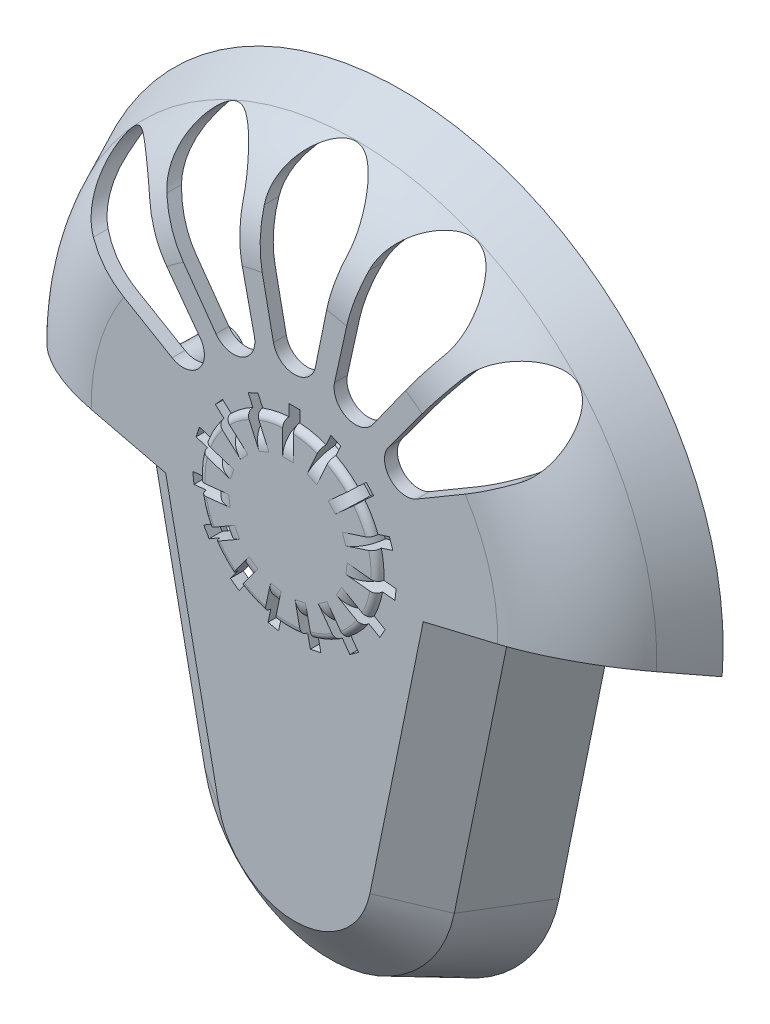
from build123d import *
from OCP.BRepFilletAPI import BRepFilletAPI_MakeChamfer

# Parameters (mm, degrees)
BOSS_EXTRUDE1_DEPTH           = 12.7
BOSS_EXTRUDE1_DRAFT           = 25
FILLET1_R                     = 12.7
CHAMFER1_SIZE                 = 4.5974
CHAMFER1_SIZE2                = 4.007661149
SHELL9_T                      = -1.524
CUT_EXTRUDE3_START            = -25.4
CUT_EXTRUDE3_DEPTH            = 90.87598769
SKETCH3_R                     = 10.6045
BOSS_EXTRUDE2_DEPTH           = 0.762
CUT_EXTRUDE5_START            = -65.757547933
SKETCH4_W                     = 1.27
SKETCH4_H                     = 2.54
CUT_EXTRUDE5_DEPTH            = 70.075547933
FILLET3_R                     = 0.762
FILLET10_R                    = 2.54
CIRPATTERN1_START             = -0.677562942
CIRPATTERN1_DEPTH             = 1.27
CIRPATTERN1_START_2           = -0.592437058
CIRPATTERN1_2_DEPTH           = 1.27
CIRPATTERN1_START_3           = -0.557233635
CIRPATTERN1_3_DEPTH           = 1.27
CIRPATTERN1_START_4           = -0.535476723
CIRPATTERN1_4_DEPTH           = 1.27
CIRPATTERN1_START_5           = -0.73907171
CIRPATTERN1_5_DEPTH           = 1.27
CIRPATTERN1_START_6           = -0.725625199
CIRPATTERN1_6_DEPTH           = 1.27
CIRPATTERN1_START_7           = -0.696508768
CIRPATTERN1_7_DEPTH           = 1.27
CIRPATTERN1_START_8           = -0.656756912
CIRPATTERN1_8_DEPTH           = 1.27
CIRPATTERN1_START_9           = -0.613243088
CIRPATTERN1_9_DEPTH           = 1.27
CIRPATTERN1_START_10          = -0.573491232
CIRPATTERN1_10_DEPTH          = 1.27
CIRPATTERN1_START_11          = -0.544374801
CIRPATTERN1_11_DEPTH          = 1.27
CIRPATTERN1_START_12          = -0.53092829
CIRPATTERN1_12_DEPTH          = 1.27
CIRPATTERN1_START_13          = -0.734523277
CIRPATTERN1_13_DEPTH          = 1.27
CIRPATTERN1_START_14          = -0.712766365
CIRPATTERN1_14_DEPTH          = 1.27
SKETCH5_R                     = 2.2225
BOSS_EXTRUDE3_DEPTH           = 9.525
BOSS_EXTRUDE3_DRAFT           = 1
BOSS_EXTRUDE3_PROFILE_2_DEPTH = 9.525
BOSS_EXTRUDE3_PROFILE_2_DRAFT = 1
BOSS_EXTRUDE3_PROFILE_3_DEPTH = 9.525
BOSS_EXTRUDE3_PROFILE_3_DRAFT = 1
SKETCH7_R                     = 1.27
CUT_EXTRUDE6_DEPTH            = 2.54
CUT_EXTRUDE6_DRAFT            = -1
CUT_EXTRUDE6_PROFILE_2_DEPTH  = 2.54
CUT_EXTRUDE6_PROFILE_2_DRAFT  = -1
CUT_EXTRUDE6_PROFILE_3_DEPTH  = 2.54
CUT_EXTRUDE6_PROFILE_3_DRAFT  = -1
SKETCH8_R                     = 7.62
BOSS_EXTRUDE4_DEPTH           = 2.54
SKETCH9_R                     = 6.35
CUT_EXTRUDE7_DEPTH            = 2.54


# Read off the part's stored shape, not the designer's step: CirPattern1
# Some blends are built 0.0001 mm under size
with BuildPart() as part:
    # Sketch1 → Boss-Extrude1 (with draft: the straight prism first)
    with BuildSketch(Plane.XY):
        with BuildLine():
            ThreePointArc((-18.667565623, -35.547959151), (0, -50.8), (18.667565623, -35.547959151))
            Line((18.667565623, -35.547959151), (24.607957551, -6.35))
            Line((24.607957551, -6.35), (37.970222689, -3.142003967))
            ThreePointArc((37.970222689, -3.142003967), (0, 38.1), (-37.970222689, -3.142003967))
            Line((-37.970222689, -3.142003967), (-24.607957551, -6.35))
            Line((-24.607957551, -6.35), (-18.667565623, -35.547959151))
        make_face()
    extrude(amount=BOSS_EXTRUDE1_DEPTH)
    # Boss-Extrude1: the draft: its side faces are tilted about the plane it starts from
    boss_extrude1_sides = [part.faces().sort_by_distance(p)[0] for p in [
        (-31.28909012, -4.746001984, 6.35),
        (-21.637761587, -20.948979575, 6.35),
        (0, -50.8, 6.35),
        (21.637761587, -20.948979575, 6.35),
        (31.28909012, -4.746001984, 6.35),
        (0, 38.1, 6.35),
    ]]
    draft(boss_extrude1_sides, Plane.XY, BOSS_EXTRUDE1_DRAFT)

    # Fillet1
    fillet1_edges = [part.edges().sort_by_distance(p)[0] for p in [
        (0, 32.177892741, 12.7),
    ]]
    fillet(fillet1_edges, radius=FILLET1_R)

    # Chamfer1: one chamfer whose edges measure the first distance from different faces: ONE call of the kernel's chamfer builder (chamfer() names one face for all edges)
    chamfer1_edges_1 = [part.edges().sort_by_distance(p)[0] for p in [
        (-16.210629894, -17.919772097, 12.7),
    ]]
    chamfer1_side_1 = [part.faces().sort_by_distance(p)[0] for p in [
        (-18.870339884, -19.404315655, 6.476027784),
    ]]
    chamfer1_edges_2 = [part.edges().sort_by_distance(p)[0] for p in [
        (0, -44.877892741, 12.7),
    ]]
    chamfer1_side_2 = [part.faces().sort_by_distance(p)[0] for p in [
        (0, -47.838946371, 6.35),
    ]]
    chamfer1_edges_3 = [part.edges().sort_by_distance(p)[0] for p in [
        (16.210629894, -17.919772097, 12.7),
    ]]
    chamfer1_side_3 = [part.faces().sort_by_distance(p)[0] for p in [
        (18.870339884, -19.404315655, 6.476027784),
    ]]
    chamfer1 = BRepFilletAPI_MakeChamfer(part.part.solid().wrapped)
    for e in chamfer1_edges_1:
        chamfer1.Add(CHAMFER1_SIZE, CHAMFER1_SIZE2, e.wrapped, chamfer1_side_1[0].wrapped)  # the first distance lies on this face
    for e in chamfer1_edges_2:
        chamfer1.Add(CHAMFER1_SIZE, CHAMFER1_SIZE2, e.wrapped, chamfer1_side_2[0].wrapped)  # the first distance lies on this face
    for e in chamfer1_edges_3:
        chamfer1.Add(CHAMFER1_SIZE, CHAMFER1_SIZE2, e.wrapped, chamfer1_side_3[0].wrapped)  # the first distance lies on this face
    add(Compound.cast(chamfer1.Shape()), mode=Mode.REPLACE)

    # Shell9
    shell9_openings = [part.faces().sort_by_distance(p)[0] for p in [
        (0, -1.798824332, 0),
    ]]
    offset(amount=SHELL9_T, openings=shell9_openings, kind=Kind.INTERSECTION)

    # Sketch2 → Cut-Extrude3 (cut)
    with BuildSketch(Plane(origin=(0, 0, 11.176), x_dir=(-1, 0, 0), z_dir=(0, 0, -1)).offset(CUT_EXTRUDE3_START)):
        with BuildLine():
            Line((4.977363157, 29.464), (2.488681579, 17.272))
            ThreePointArc((2.488681579, 17.272), (0, 15.24), (-2.488681579, 17.272))
            Line((-2.488681579, 17.272), (-4.977363157, 29.464))
            ThreePointArc((-4.977363157, 29.464), (0, 35.56), (4.977363157, 29.464))
        make_face()
        with BuildLine():
            Line((16.531135955, 24.892227382), (9.298679051, 14.766519153))
            ThreePointArc((9.298679051, 14.766519153), (6.19866644, 13.922432774), (4.751631547, 16.790995135))
            Line((4.751631547, 16.790995135), (7.437040948, 28.941179346))
            ThreePointArc((7.437040948, 28.941179346), (14.463555028, 32.485676474), (16.531135955, 24.892227382))
        make_face()
        with BuildLine():
            Line((25.226525165, 16.016362511), (14.500850439, 9.707772996))
            ThreePointArc((14.500850439, 9.707772996), (11.32552714, 10.197550441), (11.170344412, 13.40667467))
            Line((11.170344412, 13.40667467), (18.56551311, 23.414165861))
            ThreePointArc((18.56551311, 23.414165861), (26.426229994, 23.794284362), (25.226525165, 16.016362511))
        make_face()
    cut_extrude3 = extrude(amount=CUT_EXTRUDE3_DEPTH, mode=Mode.SUBTRACT)

    # Mirror1: Cut-Extrude3 across plane
    add(cut_extrude3.mirror(Plane(origin=(0, 0, 0), x_dir=(0, 0, 1), z_dir=(1, 0, 0))), mode=Mode.SUBTRACT)

    # Sketch3 → Boss-Extrude2 (add)
    with BuildSketch(Plane.XY.offset(12.7)):
        with Locations(Location((0, 0, 0), (0, 0, 180))):
            Circle(SKETCH3_R)
    extrude(amount=BOSS_EXTRUDE2_DEPTH)

    # Sketch4 → Cut-Extrude5 (cut)
    with BuildSketch(Plane.XY.offset(12.7).offset(CUT_EXTRUDE5_START)):
        with Locations((0, 10.668)):
            Rectangle(SKETCH4_W, SKETCH4_H)
    extrude(amount=CUT_EXTRUDE5_DEPTH, mode=Mode.SUBTRACT)

    # Fillet3
    fillet3_edges = [part.edges().sort_by_distance(p)[0] for p in [
        (0, -10.6045, 13.462),
    ]]
    fillet(fillet3_edges, radius=FILLET3_R - 0.0001)  # a hair under: the kernel refuses the full size

    # Fillet10
    # the kernel refuses this fillet: 2.54 mm, written as the material it takes off along each edge
    with BuildSketch(Plane(origin=(-0.635, 9.398, 13.462), x_dir=(0, -1, 0), z_dir=(1, 0, 0))) as fillet10_piece_1:
        with BuildLine():
            CenterArc((2.52726809, 2.54), FILLET10_R, 185.739170477, 84.260829523)
            Line((0, 2.286), (-0.050545362, 2.28092))
            ThreePointArc((-0.050545362, 2.28092), (-0.0508, 1.143), (-0.0508, 0))
            Line((-0.0508, 0), (0, -0.0508))
            Line((0, -0.0508), (2.52726809, -0.0508))
            Line((2.52726809, -0.0508), (2.52726809, 0))
        make_face()
    extrude(amount=1.27, mode=Mode.SUBTRACT)

    # CirPattern1 outline → CirPattern1 (cut)
    with BuildSketch(Plane(origin=(0, 0, 0), x_dir=(-0.4067366430758008, 0.9135454576426006, 0), z_dir=(0.9135454576426006, 0.4067366430758008, 0)).offset(CIRPATTERN1_START)):
        with BuildLine():
            Line((11.947047033, 10), (11.947047033, 13.462))
            Line((11.947047033, 13.462), (6.879778942, 13.462))
            ThreePointArc((6.879778942, 13.462), (8.583662741, 12.805714416), (9.407047033, 11.176))
            Line((9.407047033, 11.176), (9.52523948, 10))
            Line((9.52523948, 10), (11.947047033, 10))
        make_face()
    extrude(amount=CIRPATTERN1_DEPTH, mode=Mode.SUBTRACT)

    # CirPattern1 2 outline → CirPattern1 2 (cut)
    with BuildSketch(Plane(origin=(0, 0, 0), x_dir=(0.40673664307578905, 0.9135454576426059, 0), z_dir=(0.913545457642606, -0.406736643075789, 0)).offset(CIRPATTERN1_START_2)):
        with BuildLine():
            Line((11.947047033, 10), (11.947047033, 13.462))
            Line((11.947047033, 13.462), (6.879778942, 13.462))
            ThreePointArc((6.879778942, 13.462), (8.583662741, 12.805714416), (9.407047033, 11.176))
            Line((9.407047033, 11.176), (9.52523948, 10))
            Line((9.52523948, 10), (11.947047033, 10))
        make_face()
    extrude(amount=CIRPATTERN1_2_DEPTH, mode=Mode.SUBTRACT)

    # CirPattern1 3 outline → CirPattern1 3 (cut)
    with BuildSketch(Plane(origin=(0, 0, 0), x_dir=(0.743144825477386, 0.6691306063588673, 0), z_dir=(0.6691306063588672, -0.7431448254773863, 0)).offset(CIRPATTERN1_START_3)):
        with BuildLine():
            Line((11.972623816, 10), (11.972623816, 13.462))
            Line((11.972623816, 13.462), (6.905355726, 13.462))
            ThreePointArc((6.905355726, 13.462), (8.609239525, 12.805714416), (9.432623816, 11.176))
            Line((9.432623816, 11.176), (9.550816263, 10))
            Line((9.550816263, 10), (11.972623816, 10))
        make_face()
    extrude(amount=CIRPATTERN1_3_DEPTH, mode=Mode.SUBTRACT)

    # CirPattern1 4 outline → CirPattern1 4 (cut)
    with BuildSketch(Plane(origin=(0, 0, 0), x_dir=(0.9510565162951504, 0.3090169943749569, 0), z_dir=(0.3090169943749569, -0.9510565162951505, 0)).offset(CIRPATTERN1_START_4)):
        with BuildLine():
            Line((12.010307893, 10), (12.010307893, 13.462))
            Line((12.010307893, 13.462), (6.943039803, 13.462))
            ThreePointArc((6.943039803, 13.462), (8.646923602, 12.805714416), (9.470307893, 11.176))
            Line((9.470307893, 11.176), (9.58850034, 10))
            Line((9.58850034, 10), (12.010307893, 10))
        make_face()
    extrude(amount=CIRPATTERN1_4_DEPTH, mode=Mode.SUBTRACT)

    # CirPattern1 5 outline → CirPattern1 5 (cut)
    with BuildSketch(Plane(origin=(0, 0, 0), x_dir=(0.9945218953682743, -0.10452846326764405, 0), z_dir=(0.10452846326764405, 0.9945218953682744, 0)).offset(CIRPATTERN1_START_5)):
        with BuildLine():
            Line((12.053583343, -13.462), (12.053583343, -10))
            Line((12.053583343, -10), (9.63177579, -10))
            Line((9.63177579, -10), (9.513583343, -11.176))
            ThreePointArc((9.513583343, -11.176), (8.690199052, -12.805714416), (6.986315253, -13.462))
            Line((6.986315253, -13.462), (12.053583343, -13.462))
        make_face()
    extrude(amount=CIRPATTERN1_5_DEPTH, mode=Mode.SUBTRACT)

    # CirPattern1 6 outline → CirPattern1 6 (cut)
    with BuildSketch(Plane(origin=(0, 0, 0), x_dir=(0.8660254037844431, -0.4999999999999921, 0), z_dir=(0.4999999999999921, 0.8660254037844433, 0)).offset(CIRPATTERN1_START_6)):
        with BuildLine():
            Line((12.094967449, -13.462), (12.094967449, -10))
            Line((12.094967449, -10), (9.673159896, -10))
            Line((9.673159896, -10), (9.554967449, -11.176))
            ThreePointArc((9.554967449, -11.176), (8.731583157, -12.805714416), (7.027699358, -13.462))
            Line((7.027699358, -13.462), (12.094967449, -13.462))
        make_face()
    extrude(amount=CIRPATTERN1_6_DEPTH, mode=Mode.SUBTRACT)

    # CirPattern1 7 outline → CirPattern1 7 (cut)
    with BuildSketch(Plane(origin=(0, 0, 0), x_dir=(0.5877852522924796, -0.8090169943749428, 0), z_dir=(0.8090169943749427, 0.5877852522924798, 0)).offset(CIRPATTERN1_START_7)):
        with BuildLine():
            Line((12.127304521, -13.462), (12.127304521, -10))
            Line((12.127304521, -10), (9.705496968, -10))
            Line((9.705496968, -10), (9.587304521, -11.176))
            ThreePointArc((9.587304521, -11.176), (8.76392023, -12.805714416), (7.060036431, -13.462))
            Line((7.060036431, -13.462), (12.127304521, -13.462))
        make_face()
    extrude(amount=CIRPATTERN1_7_DEPTH, mode=Mode.SUBTRACT)

    # CirPattern1 8 outline → CirPattern1 8 (cut)
    with BuildSketch(Plane(origin=(0, 0, 0), x_dir=(-0.20791169081776606, 0.9781476007338042, 0), z_dir=(0.9781476007338042, 0.20791169081776606, 0)).offset(CIRPATTERN1_START_8)):
        with BuildLine():
            Line((-12.145003188, 13.462), (-12.145003188, 10))
            Line((-12.145003188, 10), (-9.723195635, 10))
            Line((-9.723195635, 10), (-9.605003188, 11.176))
            ThreePointArc((-9.605003188, 11.176), (-8.781618897, 12.805714416), (-7.077735098, 13.462))
            Line((-7.077735098, 13.462), (-12.145003188, 13.462))
        make_face()
    extrude(amount=CIRPATTERN1_8_DEPTH, mode=Mode.SUBTRACT)

    # CirPattern1 9 outline → CirPattern1 9 (cut)
    with BuildSketch(Plane(origin=(0, 0, 0), x_dir=(0.20791169081775301, 0.978147600733807, 0), z_dir=(0.978147600733807, -0.207911690817753, 0)).offset(CIRPATTERN1_START_9)):
        with BuildLine():
            Line((-12.145003188, 13.462), (-12.145003188, 10))
            Line((-12.145003188, 10), (-9.723195635, 10))
            Line((-9.723195635, 10), (-9.605003188, 11.176))
            ThreePointArc((-9.605003188, 11.176), (-8.781618897, 12.805714416), (-7.077735098, 13.462))
            Line((-7.077735098, 13.462), (-12.145003188, 13.462))
        make_face()
    extrude(amount=CIRPATTERN1_9_DEPTH, mode=Mode.SUBTRACT)

    # CirPattern1 10 outline → CirPattern1 10 (cut)
    with BuildSketch(Plane(origin=(0, 0, 0), x_dir=(0.5877852522924686, 0.8090169943749507, 0), z_dir=(0.8090169943749507, -0.5877852522924688, 0)).offset(CIRPATTERN1_START_10)):
        with BuildLine():
            Line((-12.127304521, 13.462), (-12.127304521, 10))
            Line((-12.127304521, 10), (-9.705496968, 10))
            Line((-9.705496968, 10), (-9.587304521, 11.176))
            ThreePointArc((-9.587304521, 11.176), (-8.76392023, 12.805714416), (-7.060036431, 13.462))
            Line((-7.060036431, 13.462), (-12.127304521, 13.462))
        make_face()
    extrude(amount=CIRPATTERN1_10_DEPTH, mode=Mode.SUBTRACT)

    # CirPattern1 11 outline → CirPattern1 11 (cut)
    with BuildSketch(Plane(origin=(0, 0, 0), x_dir=(0.8660254037844362, 0.5000000000000042, 0), z_dir=(0.5000000000000042, -0.8660254037844363, 0)).offset(CIRPATTERN1_START_11)):
        with BuildLine():
            Line((-12.094967449, 13.462), (-12.094967449, 10))
            Line((-12.094967449, 10), (-9.673159896, 10))
            Line((-9.673159896, 10), (-9.554967449, 11.176))
            ThreePointArc((-9.554967449, 11.176), (-8.731583157, 12.805714416), (-7.027699358, 13.462))
            Line((-7.027699358, 13.462), (-12.094967449, 13.462))
        make_face()
    extrude(amount=CIRPATTERN1_11_DEPTH, mode=Mode.SUBTRACT)

    # CirPattern1 12 outline → CirPattern1 12 (cut)
    with BuildSketch(Plane(origin=(0, 0, 0), x_dir=(0.994521895368273, 0.104528463267657, 0), z_dir=(0.104528463267657, -0.994521895368273, 0)).offset(CIRPATTERN1_START_12)):
        with BuildLine():
            Line((-12.053583343, 13.462), (-12.053583343, 10))
            Line((-12.053583343, 10), (-9.63177579, 10))
            Line((-9.63177579, 10), (-9.513583343, 11.176))
            ThreePointArc((-9.513583343, 11.176), (-8.690199052, 12.805714416), (-6.986315253, 13.462))
            Line((-6.986315253, 13.462), (-12.053583343, 13.462))
        make_face()
    extrude(amount=CIRPATTERN1_12_DEPTH, mode=Mode.SUBTRACT)

    # CirPattern1 13 outline → CirPattern1 13 (cut)
    with BuildSketch(Plane(origin=(0, 0, 0), x_dir=(0.9510565162951544, -0.30901699437494495, 0), z_dir=(0.3090169943749449, 0.9510565162951545, 0)).offset(CIRPATTERN1_START_13)):
        with BuildLine():
            Line((-12.010307893, -10), (-12.010307893, -13.462))
            Line((-12.010307893, -13.462), (-6.943039803, -13.462))
            ThreePointArc((-6.943039803, -13.462), (-8.646923602, -12.805714416), (-9.470307893, -11.176))
            Line((-9.470307893, -11.176), (-9.58850034, -10))
            Line((-9.58850034, -10), (-12.010307893, -10))
        make_face()
    extrude(amount=CIRPATTERN1_13_DEPTH, mode=Mode.SUBTRACT)

    # CirPattern1 14 outline → CirPattern1 14 (cut)
    with BuildSketch(Plane(origin=(0, 0, 0), x_dir=(0.743144825477395, -0.6691306063588573, 0), z_dir=(0.6691306063588572, 0.7431448254773952, 0)).offset(CIRPATTERN1_START_14)):
        with BuildLine():
            Line((-11.972623816, -10), (-11.972623816, -13.462))
            Line((-11.972623816, -13.462), (-6.905355726, -13.462))
            ThreePointArc((-6.905355726, -13.462), (-8.609239525, -12.805714416), (-9.432623816, -11.176))
            Line((-9.432623816, -11.176), (-9.550816263, -10))
            Line((-9.550816263, -10), (-11.972623816, -10))
        make_face()
    extrude(amount=CIRPATTERN1_14_DEPTH, mode=Mode.SUBTRACT)


with BuildPart() as boss_extrude3_tool:
    # Sketch5 → Boss-Extrude3 (with draft: the straight prism first)
    with BuildSketch(Plane(origin=(0, 0, 11.176), x_dir=(-1, 0, 0), z_dir=(0, 0, -1))):
        with Locations((-18.954419708, 3.175)):
            Circle(SKETCH5_R)
    extrude(amount=BOSS_EXTRUDE3_DEPTH)
    # Boss-Extrude3: the draft: its side faces are tilted about the plane it starts from
    boss_extrude3_sides = [boss_extrude3_tool.faces().sort_by_distance(p)[0] for p in [
        (21.176919708, 3.175, 6.4135),
    ]]
    draft(boss_extrude3_sides, Plane(origin=(0, 0, 11.176), x_dir=(-1, 0, 0), z_dir=(0, 0, -1)), BOSS_EXTRUDE3_DRAFT)


with BuildPart() as part_1:
    add(part.part)

    # Boss-Extrude3: add boss_extrude3_tool
    add(boss_extrude3_tool.part)


with BuildPart() as boss_extrude3_profile_2_tool:
    # Sketch5 → Boss-Extrude3 profile 2 (with draft: the straight prism first)
    with BuildSketch(Plane(origin=(0, 0, 11.176), x_dir=(-1, 0, 0), z_dir=(0, 0, -1))):
        with Locations((18.954419708, 3.175)):
            Circle(SKETCH5_R)
    extrude(amount=BOSS_EXTRUDE3_PROFILE_2_DEPTH)
    # Boss-Extrude3 profile 2: the draft: its side faces are tilted about the plane it starts from
    boss_extrude3_profile_2_sides = [boss_extrude3_profile_2_tool.faces().sort_by_distance(p)[0] for p in [
        (-16.731919708, 3.175, 6.4135),
    ]]
    draft(boss_extrude3_profile_2_sides, Plane(origin=(0, 0, 11.176), x_dir=(-1, 0, 0), z_dir=(0, 0, -1)), BOSS_EXTRUDE3_PROFILE_2_DRAFT)


with BuildPart() as part_2:
    add(part_1.part)

    # Boss-Extrude3 profile 2: add boss_extrude3_profile_2_tool
    add(boss_extrude3_profile_2_tool.part)


with BuildPart() as boss_extrude3_profile_3_tool:
    # Sketch5 → Boss-Extrude3 profile 3 (with draft: the straight prism first)
    with BuildSketch(Plane(origin=(0, 0, 11.176), x_dir=(-1, 0, 0), z_dir=(0, 0, -1))):
        with Locations((0, -33.527795656)):
            Circle(SKETCH5_R)
    extrude(amount=BOSS_EXTRUDE3_PROFILE_3_DEPTH)
    # Boss-Extrude3 profile 3: the draft: its side faces are tilted about the plane it starts from
    boss_extrude3_profile_3_sides = [boss_extrude3_profile_3_tool.faces().sort_by_distance(p)[0] for p in [
        (2.2225, -33.527795656, 6.4135),
    ]]
    draft(boss_extrude3_profile_3_sides, Plane(origin=(0, 0, 11.176), x_dir=(-1, 0, 0), z_dir=(0, 0, -1)), BOSS_EXTRUDE3_PROFILE_3_DRAFT)


with BuildPart() as part_3:
    add(part_2.part)

    # Boss-Extrude3 profile 3: add boss_extrude3_profile_3_tool
    add(boss_extrude3_profile_3_tool.part)


with BuildPart() as cut_extrude6_tool:
    # Sketch7 → Cut-Extrude6 (with draft: the straight prism first)
    with BuildSketch(Plane(origin=(0, 0, 1.651), x_dir=(-1, 0, 0), z_dir=(0, 0, -1))):
        with Locations((-18.954419708, 3.175)):
            Circle(SKETCH7_R)
    extrude(amount=-CUT_EXTRUDE6_DEPTH)
    # Cut-Extrude6: the draft: its side faces are tilted about the plane it starts from
    cut_extrude6_sides = [cut_extrude6_tool.faces().sort_by_distance(p)[0] for p in [
        (20.224419708, 3.175, 2.921),
    ]]
    draft(cut_extrude6_sides, Plane(origin=(0, 0, 1.651), x_dir=(-1, 0, 0), z_dir=(0, 0, -1)), CUT_EXTRUDE6_DRAFT)


with BuildPart() as part_4:
    add(part_3.part)

    # Cut-Extrude6: cut by cut_extrude6_tool
    add(cut_extrude6_tool.part, mode=Mode.SUBTRACT)


with BuildPart() as cut_extrude6_profile_2_tool:
    # Sketch7 → Cut-Extrude6 profile 2 (with draft: the straight prism first)
    with BuildSketch(Plane(origin=(0, 0, 1.651), x_dir=(-1, 0, 0), z_dir=(0, 0, -1))):
        with Locations((18.954419708, 3.175)):
            Circle(SKETCH7_R)
    extrude(amount=-CUT_EXTRUDE6_PROFILE_2_DEPTH)
    # Cut-Extrude6 profile 2: the draft: its side faces are tilted about the plane it starts from
    cut_extrude6_profile_2_sides = [cut_extrude6_profile_2_tool.faces().sort_by_distance(p)[0] for p in [
        (-17.684419708, 3.175, 2.921),
    ]]
    draft(cut_extrude6_profile_2_sides, Plane(origin=(0, 0, 1.651), x_dir=(-1, 0, 0), z_dir=(0, 0, -1)), CUT_EXTRUDE6_PROFILE_2_DRAFT)


with BuildPart() as part_5:
    add(part_4.part)

    # Cut-Extrude6 profile 2: cut by cut_extrude6_profile_2_tool
    add(cut_extrude6_profile_2_tool.part, mode=Mode.SUBTRACT)


with BuildPart() as cut_extrude6_profile_3_tool:
    # Sketch7 → Cut-Extrude6 profile 3 (with draft: the straight prism first)
    with BuildSketch(Plane(origin=(0, 0, 1.651), x_dir=(-1, 0, 0), z_dir=(0, 0, -1))):
        with Locations((0, -33.527795656)):
            Circle(SKETCH7_R)
    extrude(amount=-CUT_EXTRUDE6_PROFILE_3_DEPTH)
    # Cut-Extrude6 profile 3: the draft: its side faces are tilted about the plane it starts from
    cut_extrude6_profile_3_sides = [cut_extrude6_profile_3_tool.faces().sort_by_distance(p)[0] for p in [
        (1.27, -33.527795656, 2.921),
    ]]
    draft(cut_extrude6_profile_3_sides, Plane(origin=(0, 0, 1.651), x_dir=(-1, 0, 0), z_dir=(0, 0, -1)), CUT_EXTRUDE6_PROFILE_3_DRAFT)


with BuildPart() as part_6:
    add(part_5.part)

    # Cut-Extrude6 profile 3: cut by cut_extrude6_profile_3_tool
    add(cut_extrude6_profile_3_tool.part, mode=Mode.SUBTRACT)

    # Sketch8 → Boss-Extrude4 (add)
    with BuildSketch(Plane(origin=(0, 0, 11.176), x_dir=(-1, 0, 0), z_dir=(0, 0, -1))):
        with Locations(Location((0, 0, 0), (0, 0, 180))):
            Circle(SKETCH8_R)
    extrude(amount=BOSS_EXTRUDE4_DEPTH)

    # Sketch9 → Cut-Extrude7 (cut)
    with BuildSketch(Plane(origin=(0, 0, 8.636), x_dir=(-1, 0, 0), z_dir=(0, 0, -1))):
        Circle(SKETCH9_R)
    extrude(amount=-CUT_EXTRUDE7_DEPTH, mode=Mode.SUBTRACT)


solid = part_6.part
